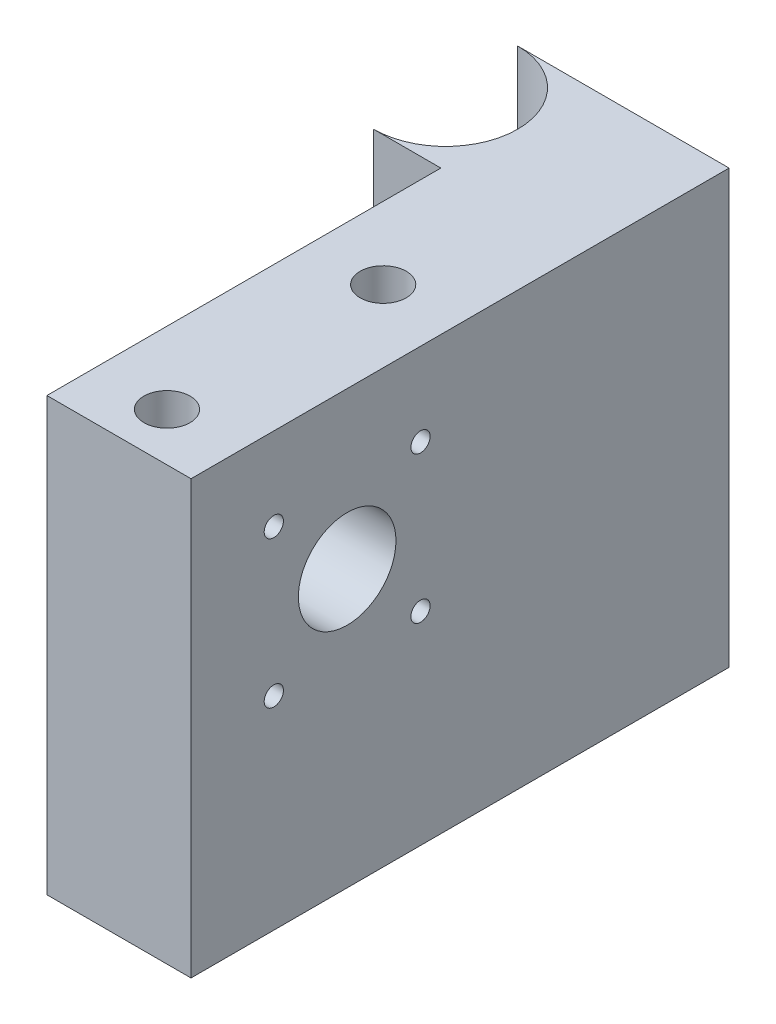
from build123d import *

# Parameters (mm, degrees)
SKETCH1_R           = 2.4
BOSS_EXTRUDE1_DEPTH = 45
CUT_EXTRUDE1_REACH  = 73.484
SKETCH2_R           = 5.08
SKETCH2_R_2         = 1


with BuildPart() as part:
    # Sketch1 → Boss-Extrude1 (new body)
    with BuildSketch(Plane(origin=(0, 0, 0), x_dir=(1, 0, 0), z_dir=(0, 1, 0))):
        with BuildLine():
            Line((-14.5, 51), (7.5, 51))
            Line((7.5, 51), (7.5, -5))
            Line((7.5, -5), (-7.5, -5))
            Line((-7.5, -5), (-7.5, 36))
            Line((-7.5, 36), (-14.5, 36))
            ThreePointArc((-14.5, 36), (-7, 43.5), (-14.5, 51))
        make_face()
        with Locations((0, 22.5)):
            Circle(SKETCH1_R, mode=Mode.SUBTRACT)
        Circle(SKETCH1_R, mode=Mode.SUBTRACT)
    extrude(amount=BOSS_EXTRUDE1_DEPTH)

    # Sketch2 → Cut-Extrude1 (cut, up to next)
    with BuildSketch(Plane(origin=(7.5, 0, 0), x_dir=(0, 0, -1), z_dir=(1, 0, 0)), mode=Mode.PRIVATE) as cut_extrude1_sk1:
        with Locations((11.25, 28.75)):
            Circle(SKETCH2_R)
    cut_extrude1_tool1 = extrude(cut_extrude1_sk1.sketch, amount=-CUT_EXTRUDE1_REACH, mode=Mode.PRIVATE) & part.part
    # Sketch2 → Cut-Extrude1 (cut, up to next)
    with BuildSketch(Plane(origin=(7.5, 0, 0), x_dir=(0, 0, -1), z_dir=(1, 0, 0)), mode=Mode.PRIVATE) as cut_extrude1_sk2:
        with Locations((3.617, 36.383)):
            Circle(SKETCH2_R_2)
    cut_extrude1_tool2 = extrude(cut_extrude1_sk2.sketch, amount=-CUT_EXTRUDE1_REACH, mode=Mode.PRIVATE) & part.part
    # Sketch2 → Cut-Extrude1 (cut, up to next)
    with BuildSketch(Plane(origin=(7.5, 0, 0), x_dir=(0, 0, -1), z_dir=(1, 0, 0)), mode=Mode.PRIVATE) as cut_extrude1_sk3:
        with Locations((18.883, 36.383)):
            Circle(SKETCH2_R_2)
    cut_extrude1_tool3 = extrude(cut_extrude1_sk3.sketch, amount=-CUT_EXTRUDE1_REACH, mode=Mode.PRIVATE) & part.part
    # Sketch2 → Cut-Extrude1 (cut, up to next)
    with BuildSketch(Plane(origin=(7.5, 0, 0), x_dir=(0, 0, -1), z_dir=(1, 0, 0)), mode=Mode.PRIVATE) as cut_extrude1_sk4:
        with Locations((18.883, 21.117)):
            Circle(SKETCH2_R_2)
    cut_extrude1_tool4 = extrude(cut_extrude1_sk4.sketch, amount=-CUT_EXTRUDE1_REACH, mode=Mode.PRIVATE) & part.part
    # Sketch2 → Cut-Extrude1 (cut, up to next)
    with BuildSketch(Plane(origin=(7.5, 0, 0), x_dir=(0, 0, -1), z_dir=(1, 0, 0)), mode=Mode.PRIVATE) as cut_extrude1_sk5:
        with Locations((3.617, 21.117)):
            Circle(SKETCH2_R_2)
    cut_extrude1_tool5 = extrude(cut_extrude1_sk5.sketch, amount=-CUT_EXTRUDE1_REACH, mode=Mode.PRIVATE) & part.part
    add(cut_extrude1_tool1.solids().sort_by_distance((7.5, 28.75, -11.25))[0], mode=Mode.SUBTRACT)
    add(cut_extrude1_tool2.solids().sort_by_distance((7.5, 36.383, -3.617))[0], mode=Mode.SUBTRACT)
    add(cut_extrude1_tool3.solids().sort_by_distance((7.5, 36.383, -18.883))[0], mode=Mode.SUBTRACT)
    add(cut_extrude1_tool4.solids().sort_by_distance((7.5, 21.117, -18.883))[0], mode=Mode.SUBTRACT)
    add(cut_extrude1_tool5.solids().sort_by_distance((7.5, 21.117, -3.617))[0], mode=Mode.SUBTRACT)


solid = part.part
